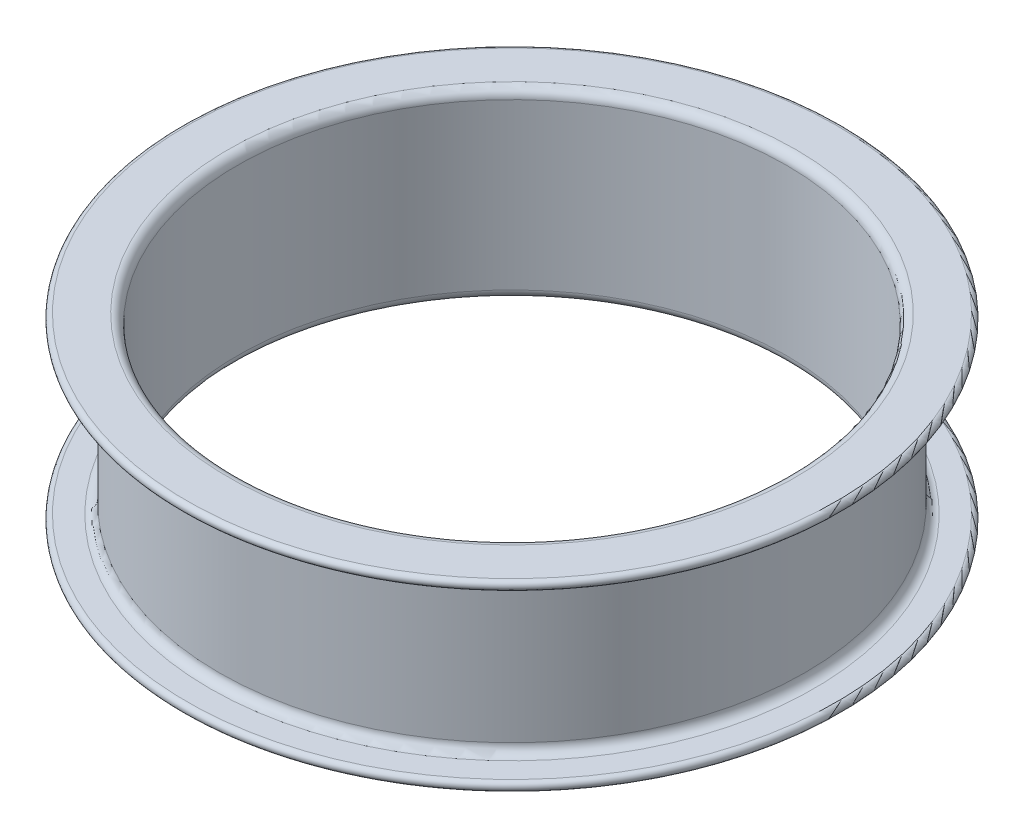
from build123d import *

# Parameters (mm, degrees)
FILLET1_R = 0.5
FILLET2_R = 0.25
FILLET3_R = 0.25


with BuildPart() as part:
    # Sketch2 → Revolve1 (revolve)
    with BuildSketch(Plane.YZ, mode=Mode.PRIVATE) as revolve1_sk:
        Polygon((-5, 15), (-5, 18), (-4.5, 18), (-4.5, 16), (4.5, 16), (4.5, 18), (5, 18), (5, 15), align=None)
    revolve(revolve1_sk.sketch.rotate(Axis((0, -17.275669785, 0), (0, 1, 0)), 180), axis=Axis((0, -17.275669785, 0), (0, 1, 0)))

    # Fillet1
    fillet1_edges = [part.edges().sort_by_distance(p)[0] for p in [
        (0, -5, 15),
        (0, 5, 15),
        (0, 4.5, 16),
        (0, -4.5, 16),
    ]]
    fillet(fillet1_edges, radius=FILLET1_R)

    # Fillet2
    fillet2_edges = [part.edges().sort_by_distance(p)[0] for p in [
        (0, 5, 18),
        (0, 4.5, 18),
    ]]
    fillet(fillet2_edges, radius=FILLET2_R - 0.0001)  # a hair under: the kernel refuses the full size

    # Fillet3
    fillet3_edges = [part.edges().sort_by_distance(p)[0] for p in [
        (0, -4.5, 18),
        (0, -5, 18),
    ]]
    fillet(fillet3_edges, radius=FILLET3_R - 0.0001)  # a hair under: the kernel refuses the full size


solid = part.part
